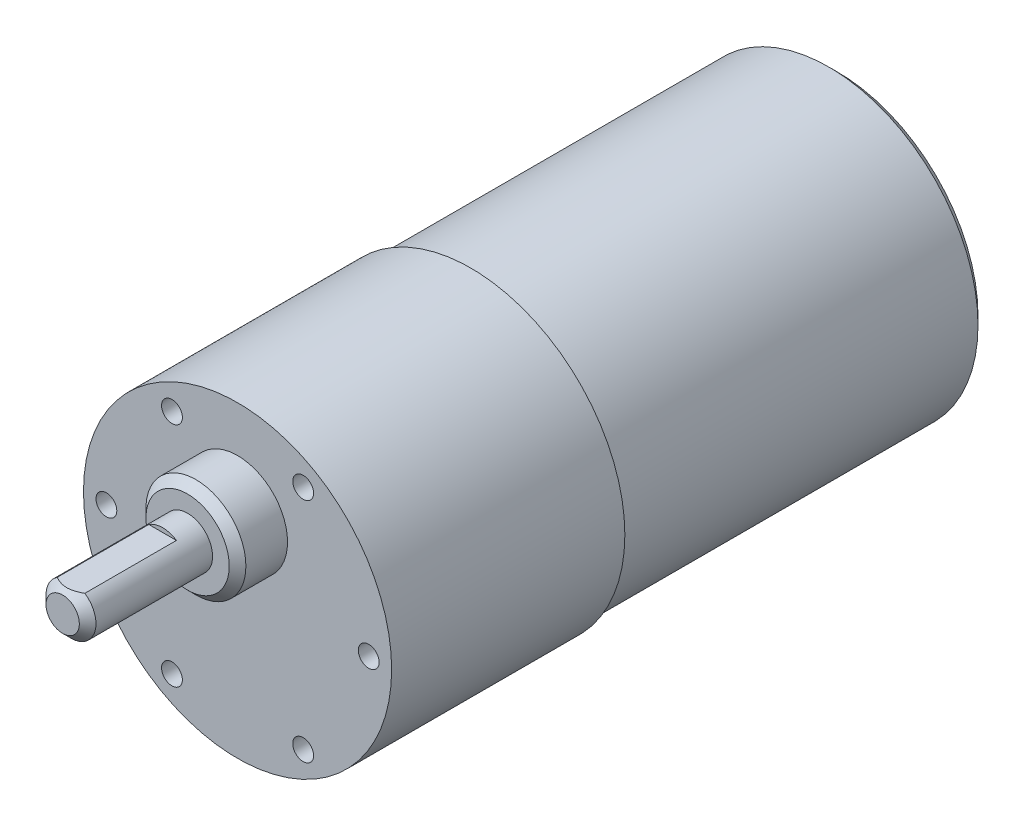
from build123d import *

# Parameters (mm, degrees)
SKETCH_1_R          = 17.9
EXTRUDE_1_DEPTH     = 44
SKETCH_2_R          = 18.5
EXTRUDE_2_DEPTH     = 28
SKETCH_3_R          = 6
EXTRUDE_3_DEPTH     = 6
SKETCH_4_R          = 3
EXTRUDE_4_DEPTH     = 15
CUT_EXTRUDE_START   = -12
CUT_EXTRUDE_1_DEPTH = 12
M3X0_5_1_D          = 2.5
M3X0_5_1_DEPTH      = 8.5
M3X0_5_1_TIP        = 0.751075774
CHAMFER_1_SIZE      = 1
CHAMFER_2_SIZE      = 1
CHAMFER_3_SIZE      = 1


with BuildPart() as part:
    # ｽｹｯﾁ1 → ﾎﾞｽ - 押し出し1 (new body)
    with BuildSketch(Plane.XY):
        Circle(SKETCH_1_R)
    extrude(amount=EXTRUDE_1_DEPTH)

    # ｽｹｯﾁ2 → ﾎﾞｽ - 押し出し2 (add)
    with BuildSketch(Plane.XY.offset(44)):
        Circle(SKETCH_2_R)
    extrude(amount=EXTRUDE_2_DEPTH)

    # ｽｹｯﾁ3 → ﾎﾞｽ - 押し出し3 (add)
    with BuildSketch(Plane.XY.offset(72)):
        with Locations((0, 7)):
            Circle(SKETCH_3_R)
    extrude(amount=EXTRUDE_3_DEPTH)

    # ｽｹｯﾁ4 → ﾎﾞｽ - 押し出し4 (add)
    with BuildSketch(Plane.XY.offset(78)):
        with Locations((0, 7)):
            Circle(SKETCH_4_R)
    extrude(amount=EXTRUDE_4_DEPTH)

    # ｽｹｯﾁ5 → ｶｯﾄ - 押し出し1 (cut)
    with BuildSketch(Plane.XY.offset(93).offset(CUT_EXTRUDE_START)):
        with BuildLine():
            ThreePointArc((1.658312395, 9.5), (0, 10), (-1.658312395, 9.5))
            Line((-1.658312395, 9.5), (0, 9.5))
            Line((0, 9.5), (1.658312395, 9.5))
        make_face()
    extrude(amount=CUT_EXTRUDE_1_DEPTH, mode=Mode.SUBTRACT)

    # M3x0.5 ねじ穴1
    with Locations(Plane(origin=(-15.75, 0, 72), x_dir=(1, 0, 0), z_dir=(0, 0, 1))):
        with Locations((0, 0), (7.875, -13.63990011), (23.625, -13.63990011), (31.5, 0), (23.625, 13.63990011), (7.875, 13.63990011)):
            Hole(M3X0_5_1_D / 2, depth=M3X0_5_1_DEPTH)
            with Locations((0, 0, -(M3X0_5_1_DEPTH + M3X0_5_1_TIP / 2))):  # 118° drill point
                Cone(0, M3X0_5_1_D / 2, M3X0_5_1_TIP, mode=Mode.SUBTRACT)

    # 面取り1
    # the kernel refuses this chamfer: 1 mm, written as the material it takes off along each edge
    with BuildSketch(Plane(origin=(0, 7, 93), x_dir=(0.27051002147704706, 0.9627171590246472, 0), z_dir=(0.9627171590246472, -0.27051002147704706, 0))) as chamfer_1_piece_1:
        Polygon((3, -CHAMFER_1_SIZE), (3 - CHAMFER_1_SIZE, 0), (3, 0), align=None)
    revolve(axis=Axis((0, 7, 93), (0, 0, 1)), revolution_arc=285.694618346, mode=Mode.SUBTRACT)
    with BuildSketch(Plane(origin=(0, 7, 93), x_dir=(1, 0, 0), z_dir=(0, -1, 0))) as chamfer_1_piece_2:
        Polygon((3, -CHAMFER_1_SIZE), (3 - CHAMFER_1_SIZE, 0), (3, 0), align=None)
    revolve(axis=Axis((0, 7, 93), (0, 0, 1)), revolution_arc=105.565976033, mode=Mode.SUBTRACT)

    # 面取り2
    chamfer_2_edges = [part.edges().sort_by_distance(p)[0] for p in [
        (-6, 7, 78),
    ]]
    chamfer(chamfer_2_edges, length=CHAMFER_2_SIZE)

    # 面取り3
    chamfer_3_edges = [part.edges().sort_by_distance(p)[0] for p in [
        (-17.9, 0, 0),
    ]]
    chamfer(chamfer_3_edges, length=CHAMFER_3_SIZE)


solid = part.part
